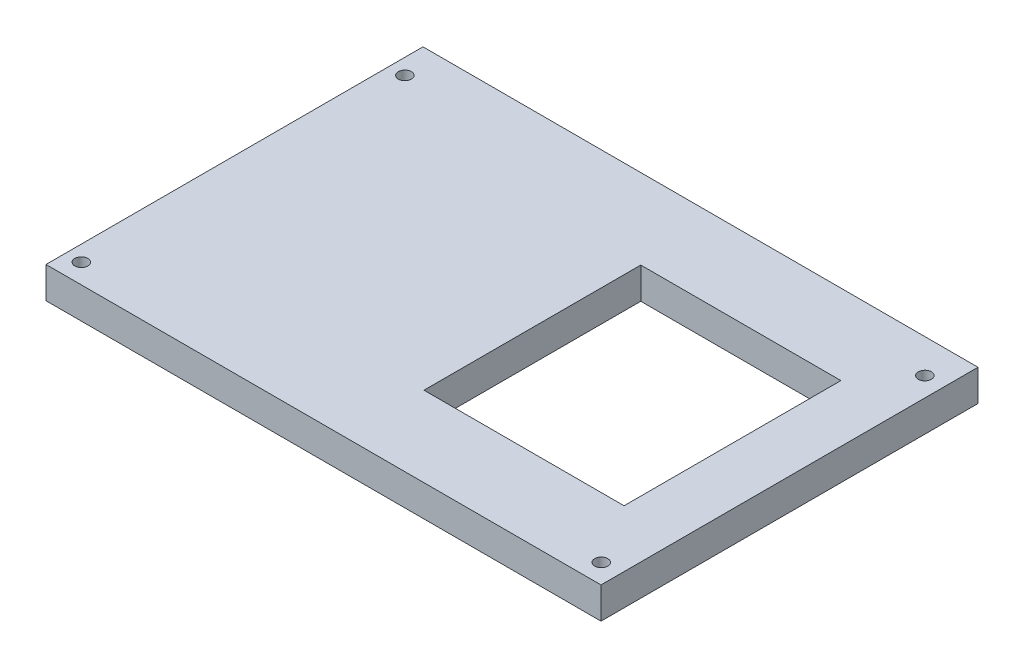
from build123d import *

# Parameters (mm, degrees)
SKETCH2_W           = 106
SKETCH2_H           = 6
BOSS_EXTRUDE1_DEPTH = 72
SKETCH4_R           = 1.25
CUT_EXTRUDE1_DEPTH  = 90.604687377
SKETCH5_R           = 1.75
CUT_EXTRUDE2_DEPTH  = 10
SKETCH6_W           = 38.22100301
SKETCH6_H           = 41.408309334
CUT_EXTRUDE3_DEPTH  = 10


with BuildPart() as part:
    # Sketch2 → Boss-Extrude1 (new body)
    with BuildSketch(Plane.XY):
        Rectangle(SKETCH2_W, SKETCH2_H)
    extrude(amount=BOSS_EXTRUDE1_DEPTH)

    # Sketch4 → Cut-Extrude1 (cut, through all)
    with BuildSketch(Plane(origin=(0, 3, 0), x_dir=(1, 0, 0), z_dir=(0, 1, 0))):
        with Locations((-50.004878073, -68.250693227)):
            Circle(SKETCH4_R)
        with Locations((49.295121927, -68.250693227)):
            Circle(SKETCH4_R)
        with Locations((49.295121927, -6.450693227)):
            Circle(SKETCH4_R)
        with Locations((-50.004878073, -6.450693227)):
            Circle(SKETCH4_R)
    extrude(amount=-CUT_EXTRUDE1_DEPTH, mode=Mode.SUBTRACT)

    # Sketch5 → Cut-Extrude2 (cut)
    with BuildSketch(Plane(origin=(0, 0, 0), x_dir=(-1, 0, 0), z_dir=(0, 0, -1))):
        Circle(SKETCH5_R)
        with Locations((26.5, 0)):
            Circle(SKETCH5_R)
        with Locations((-26.5, 0)):
            Circle(SKETCH5_R)
    extrude(amount=-CUT_EXTRUDE2_DEPTH, mode=Mode.SUBTRACT)

    # Sketch6 → Cut-Extrude3 (cut)
    with BuildSketch(Plane(origin=(0, 3, 0), x_dir=(1, 0, 0), z_dir=(0, 1, 0))):
        with Locations((23, -36)):
            Rectangle(SKETCH6_W, SKETCH6_H)
    extrude(amount=-CUT_EXTRUDE3_DEPTH, mode=Mode.SUBTRACT)


solid = part.part
